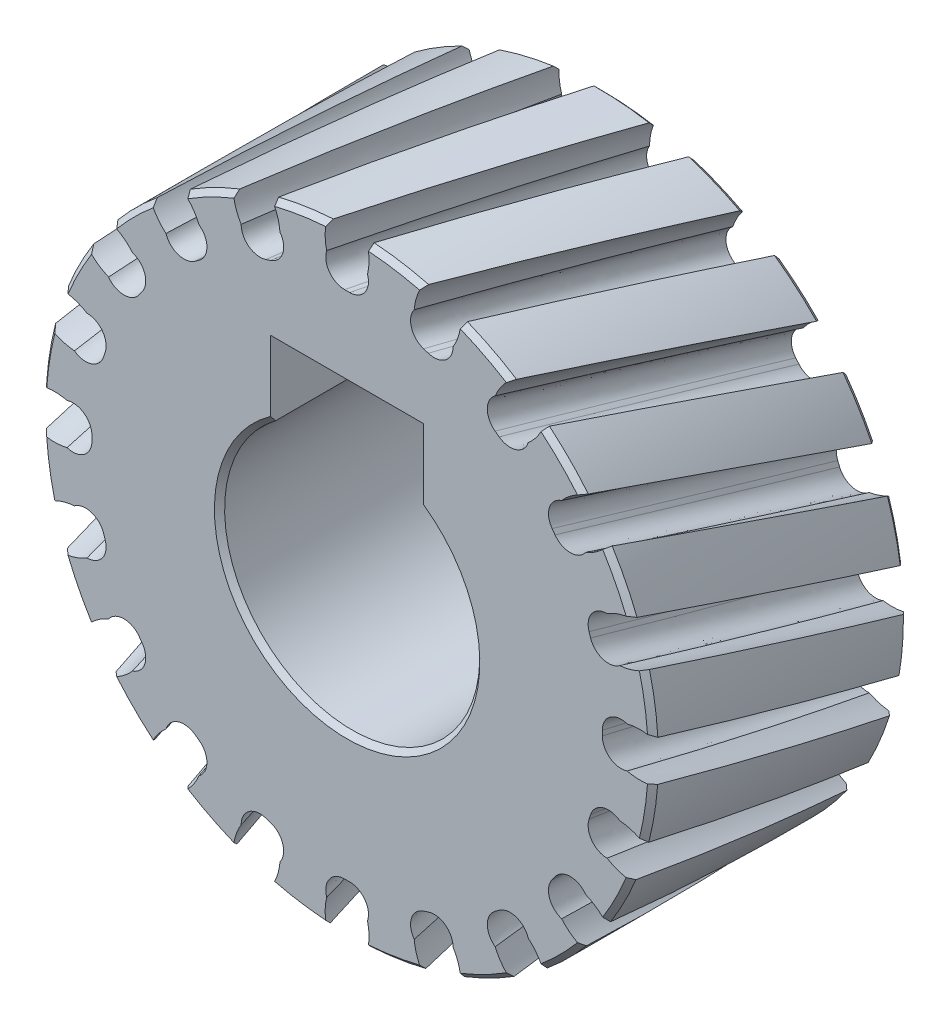
from build123d import *

# Parameters (mm, degrees)
BOSS_EXTRUDE1_DEPTH      = 25
BOSS_EXTRUDE1_DEPTH_BACK = 25
SKETCH1_R                = 60
CHAMFER1_SIZE            = 1
CUT_SWEEP1_PITCH         = 1300
CUT_SWEEP1_HEIGHT        = 50
CUT_SWEEP1_RADIUS        = 45
CUT_SWEEP1_START_ANGLE   = 90
CIRPATTERN1_COUNT        = 20


with BuildPart() as part:
    # Sketch1 → Boss-Extrude1 (new, two sides: drawn at the far end of the back side and taken through both)
    with BuildSketch(Plane.XY.offset(-BOSS_EXTRUDE1_DEPTH_BACK)):
        with Locations((-59.881684693, -3.766143691)):
            Circle(SKETCH1_R)
        with BuildLine():
            Line((-74.881684693, 16.233856309), (-74.881684693, 31.233856309))
            Line((-74.881684693, 31.233856309), (-44.881684693, 31.233856309))
            Line((-44.881684693, 31.233856309), (-44.881684693, 16.233856309))
            ThreePointArc((-44.881684693, 16.233856309), (-59.881684693, -28.766143691), (-74.881684693, 16.233856309))
        make_face(mode=Mode.SUBTRACT)
    extrude(amount=BOSS_EXTRUDE1_DEPTH + BOSS_EXTRUDE1_DEPTH_BACK)

    # Chamfer1
    chamfer1_edges = [part.edges().sort_by_distance(p)[0] for p in [
        (-119.881684693, -3.766143691, 25),
        (-59.881684693, -28.766143691, 25),
        (-119.881684693, -3.766143691, -25),
        (-59.881684693, -28.766143691, -25),
    ]]
    chamfer(chamfer1_edges, length=CHAMFER1_SIZE)

    # Cut-Sweep1: sweep along a helix
    with BuildLine() as cut_sweep1_path:
        add(Helix(CUT_SWEEP1_PITCH, CUT_SWEEP1_HEIGHT, CUT_SWEEP1_RADIUS, center=(-59.881684693, -3.766143691, 25), direction=(0, 0, -1), mode=Mode.PRIVATE).rotate(Axis((-59.881684693, -3.766143691, 25), (0, 0, -1)), CUT_SWEEP1_START_ANGLE))
    # Sketch4 → Cut-Sweep1 (sweep, cut)
    with BuildSketch(Plane.XY.offset(25)):
        with BuildLine():
            Line((-60.37010927, 46.233856309), (-59.393260117, 46.233856309))
            ThreePointArc((-59.393260117, 46.233856309), (-56.393260117, 47.769186908), (-55.883907533, 51.100522975))
            ThreePointArc((-55.883907533, 51.100522975), (-55.586872525, 53.600522975), (-55.883907533, 56.100522975))
            ThreePointArc((-55.883907533, 56.100522975), (-59.881684693, 56.233856309), (-63.879461853, 56.100522975))
            ThreePointArc((-63.879461853, 56.100522975), (-64.176496862, 53.600522975), (-63.879461853, 51.100522975))
            ThreePointArc((-63.879461853, 51.100522975), (-63.37010927, 47.769186908), (-60.37010927, 46.233856309))
        make_face()
    cut_sweep1 = sweep(path=cut_sweep1_path.line, is_frenet=True, mode=Mode.SUBTRACT)

    # CirPattern1: Cut-Sweep1 ×20 about axis
    cirpattern1_axis = Axis((-59.881684693, -3.766143691, -25), (0, 0, 1))
    for i in range(1, CIRPATTERN1_COUNT):
        add(cut_sweep1.rotate(cirpattern1_axis, i * 360 / CIRPATTERN1_COUNT), mode=Mode.SUBTRACT)


solid = part.part
